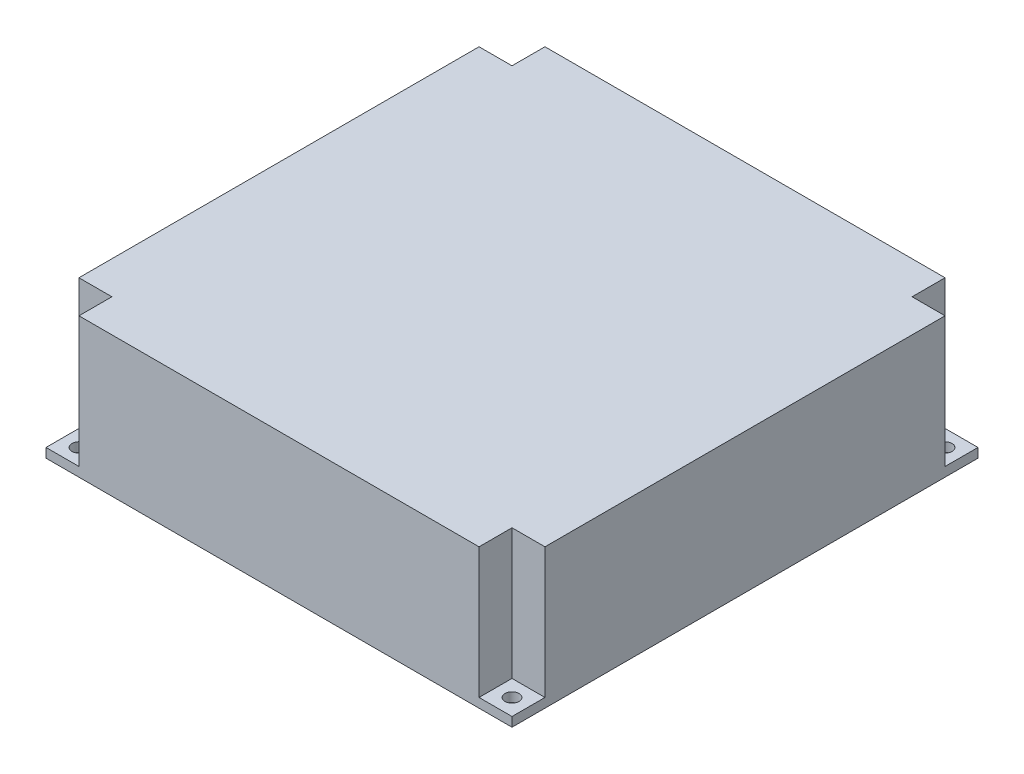
from build123d import *

# Parameters (mm, degrees)
CROQUIS1_W              = 100
CROQUIS1_H              = 100
SALIENTE_EXTRUIR1_DEPTH = 30
CROQUIS2_R              = 1.5
CORTAR_EXTRUIR1_DEPTH   = 38
CROQUIS3_W              = 7.071067812
CROQUIS3_H              = 7.071067812
CORTAR_EXTRUIR2_DEPTH   = 28
VACIADO1_START          = -48
VACIADO1_OUTLINE_W      = 28
VACIADO1_OUTLINE_H      = 81.857864376
VACIADO1_DEPTH          = 96
VACIADO1_START_2        = -40.928932188
VACIADO1_2_OUTLINE_W    = 28
VACIADO1_2_OUTLINE_H    = 7.071067812
VACIADO1_2_DEPTH        = 81.857864376


# Read off the part's stored shape, not the designer's step: Vaciado1
with BuildPart() as part:
    # Croquis1 → Saliente-Extruir1 (new body)
    with BuildSketch(Plane(origin=(0, 0, 0), x_dir=(1, 0, 0), z_dir=(0, 1, 0))):
        Rectangle(CROQUIS1_W, CROQUIS1_H)
    extrude(amount=SALIENTE_EXTRUIR1_DEPTH)

    # Croquis2 → Cortar-Extruir1 (cut)
    with BuildSketch(Plane(origin=(0, 30, 0), x_dir=(1, 0, 0), z_dir=(0, 1, 0))):
        with Locations(Location((-46.464466094, -46.464466094, 0), (0, 0, 270))):
            Circle(CROQUIS2_R)
        with Locations(Location((-46.464466094, 46.464466094, 0), (0, 0, 270))):
            Circle(CROQUIS2_R)
        with Locations(Location((46.464466094, 46.464466094, 0), (0, 0, 270))):
            Circle(CROQUIS2_R)
        with Locations(Location((46.464466094, -46.464466094, 0), (0, 0, 270))):
            Circle(CROQUIS2_R)
    extrude(amount=-CORTAR_EXTRUIR1_DEPTH, mode=Mode.SUBTRACT)

    # Croquis3 → Cortar-Extruir2 (cut)
    with BuildSketch(Plane(origin=(0, 30, 0), x_dir=(1, 0, 0), z_dir=(0, 1, 0))):
        with Locations((-46.464466094, -46.464466094)):
            Rectangle(CROQUIS3_W, CROQUIS3_H)
        with Locations((-46.464466094, 46.464466094)):
            Rectangle(CROQUIS3_W, CROQUIS3_H)
        with Locations((46.464466094, 46.464466094)):
            Rectangle(CROQUIS3_W, CROQUIS3_H)
        with Locations((46.464466094, -46.464466094)):
            Rectangle(CROQUIS3_W, CROQUIS3_H)
    extrude(amount=-CORTAR_EXTRUIR2_DEPTH, mode=Mode.SUBTRACT)

    # Vaciado1 outline → Vaciado1 (cut)
    with BuildSketch(Plane.YZ.offset(VACIADO1_START)):
        with Locations((14, 0)):
            Rectangle(VACIADO1_OUTLINE_W, VACIADO1_OUTLINE_H)
    extrude(amount=VACIADO1_DEPTH, mode=Mode.SUBTRACT)

    # Vaciado1 2 outline → Vaciado1 2 (cut)
    with BuildSketch(Plane.YZ.offset(VACIADO1_START_2)):
        with Locations((14, -44.464466094)):
            Rectangle(VACIADO1_2_OUTLINE_W, VACIADO1_2_OUTLINE_H)
        with Locations((14, 44.464466094)):
            Rectangle(VACIADO1_2_OUTLINE_W, VACIADO1_2_OUTLINE_H)
    extrude(amount=VACIADO1_2_DEPTH, mode=Mode.SUBTRACT)


solid = part.part
